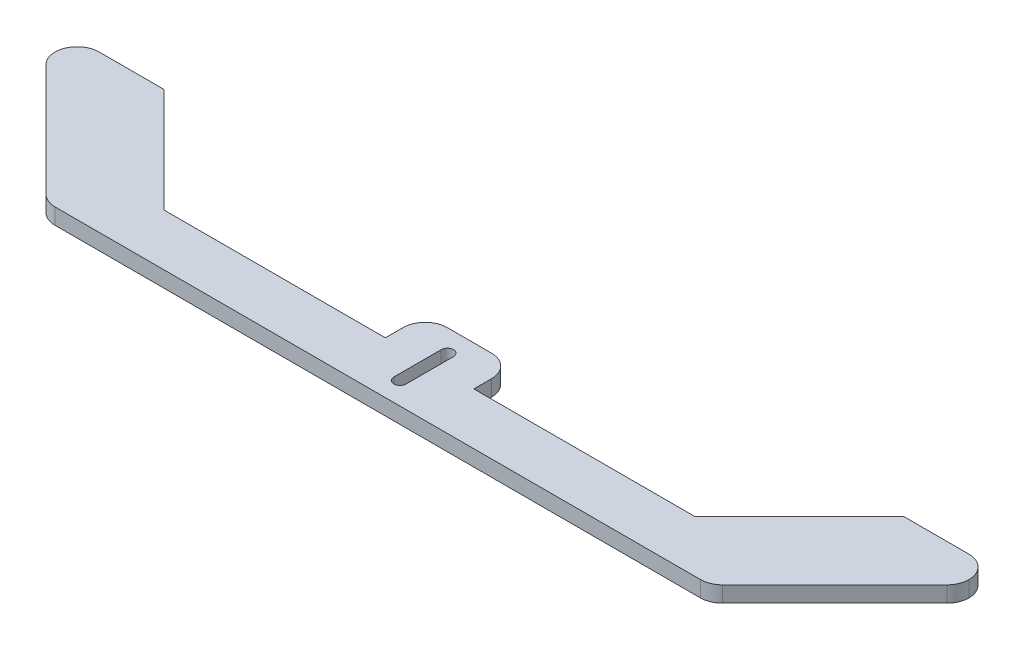
from build123d import *

# Parameters (mm, degrees)
BOSS_EXTRUDE1_DEPTH = 4.572
FILLET3_R           = 6.35
FILLET2_R           = 6.35


with BuildPart() as part:
    # Sketch1 → Boss-Extrude1 (new body)
    with BuildSketch(Plane(origin=(0, 0, 0), x_dir=(1, 0, 0), z_dir=(0, 1, 0))):
        Polygon((15.4, 12.401654114), (15.4, 0.971654114), (78.9, 0.971654114), (108.87813576, 30.949789874), (133.871024484, 30.949789874), (133.871024484, 22.022678598), (97.95, -13.898345886), (15.4, -13.898345886), (-10, -13.898345886), (-92.55, -13.898345886), (-128.471024484, 22.022678598), (-128.471024484, 30.949789874), (-103.47813576, 30.949789874), (-73.5, 0.971654114), (-10, 0.971654114), (-10, 12.401654114), align=None)
        with BuildLine():
            Line((0.95, -7.548345886), (0.95, 6.051654114))
            ThreePointArc((0.95, 6.051654114), (2.7, 7.801654114), (4.45, 6.051654114))
            Line((4.45, 6.051654114), (4.45, -7.548345886))
            ThreePointArc((4.45, -7.548345886), (2.7, -9.298345886), (0.95, -7.548345886))
        make_face(mode=Mode.SUBTRACT)
    extrude(amount=BOSS_EXTRUDE1_DEPTH)

    # Fillet3
    # the kernel refuses this fillet: 6.35 mm, written as the material it takes off along each edge
    with BuildSketch(Plane(origin=(133.871024484, -15.875, -30.949789874), x_dir=(0, 0, 1), z_dir=(0, 1, 0)), Plane(origin=(-128.471024484, -15.875, -30.949789874), x_dir=(1, 0, 0), z_dir=(0, 1, 0))) as fillet3_piece_1:
        with BuildLine():
            CenterArc((FILLET3_R, -FILLET3_R), FILLET3_R, 90, 90)
            Line((0, -FILLET3_R), (0, 0))
            Line((0, 0), (FILLET3_R, 0))
        make_face()
    extrude(amount=36.322, mode=Mode.SUBTRACT)
    with BuildSketch(Plane(origin=(-128.471024484, -6.575640303, -22.022678598), x_dir=(0, 0, -1), z_dir=(0, 1, 0)), Plane(origin=(133.871024484, -6.575640303, -22.022678598), x_dir=(-0.7071067811865476, 0, 0.7071067811865476), z_dir=(0, 1, 0)), Plane(origin=(97.95, -6.575640303, 13.898345886), x_dir=(-1, 0, 0), z_dir=(0, 1, 0)), Plane(origin=(-92.55, -6.575640303, 13.898345886), x_dir=(-0.7071067811865476, 0, -0.7071067811865476), z_dir=(0, 1, 0))) as fillet3_piece_2:
        with BuildLine():
            CenterArc((FILLET3_R * 0.414213562373, -FILLET3_R), FILLET3_R, 90, 45)
            Line((-FILLET3_R * 0.292893218813, -FILLET3_R * 0.292893218813), (0, 0))
            Line((0, 0), (FILLET3_R * 0.414213562373, 0))
        make_face()
    extrude(amount=17.723280605, mode=Mode.SUBTRACT)

    # Fillet2
    fillet2_edges = [part.edges().sort_by_distance(p)[0] for p in [
        (-10, 2.286, -12.401654114),
        (15.4, 2.286, -12.401654114),
    ]]
    fillet(fillet2_edges, radius=FILLET2_R)


solid = part.part
